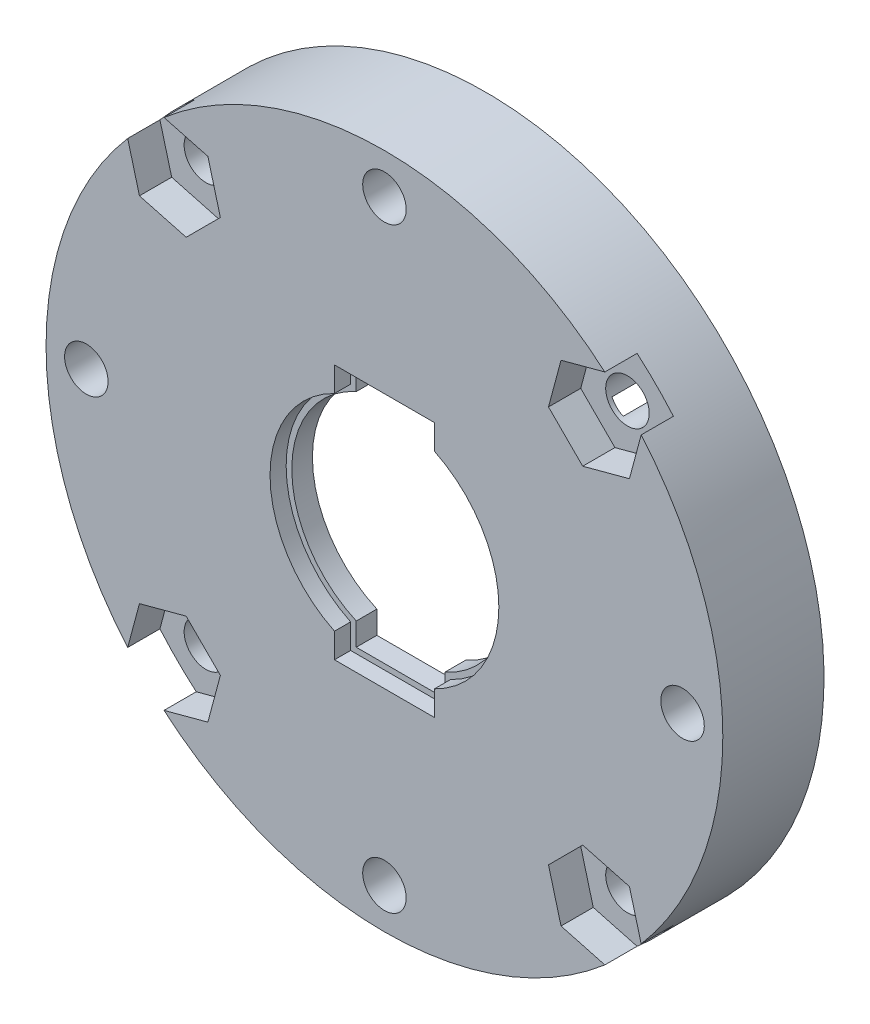
from build123d import *

# Parameters (mm, degrees)
SKETCH3_R           = 21
BOSS_EXTRUDE2_DEPTH = 1
SKETCH4_R           = 21
BOSS_EXTRUDE3_DEPTH = 5.28
SKETCH5_R           = 17.25
CUT_EXTRUDE1_DEPTH  = 4
CUT_EXTRUDE2_DEPTH  = 2
SKETCH8_R           = 1.35
CUT_EXTRUDE4_DEPTH  = 31.355203837
CIRPATTERN1_COUNT   = 4
CIRPATTERN2_COUNT   = 8


with BuildPart() as part:
    # Sketch3 → Boss-Extrude2 (new body)
    with BuildSketch(Plane.XY):
        Circle(SKETCH3_R)
        with BuildLine():
            Line((-3.099988, -6.387493593), (-3.099988, -7.924679))
            Line((-3.099988, -7.924679), (3.100012, -7.924679))
            Line((3.100012, -7.924679), (3.100012, -6.387481945))
            ThreePointArc((3.100012, -6.387481945), (7.1, 0), (3.100012, 6.387481945))
            Line((3.100012, 6.387481945), (3.100012, 7.924431))
            Line((3.100012, 7.924431), (-3.099988, 7.924431))
            Line((-3.099988, 7.924431), (-3.099988, 6.387493593))
            ThreePointArc((-3.099988, 6.387493593), (-7.1, 0), (-3.099988, -6.387493593))
        make_face(mode=Mode.SUBTRACT)
    extrude(amount=-BOSS_EXTRUDE2_DEPTH)

    # Sketch4 → Boss-Extrude3 (add)
    with BuildSketch(Plane(origin=(0, 0, -1), x_dir=(-1, 0, 0), z_dir=(0, 0, -1))):
        Circle(SKETCH4_R)
        with BuildLine():
            Line((2.749988, 6.164419356), (2.749988, 7.574431))
            Line((2.749988, 7.574431), (-2.750012, 7.574431))
            Line((-2.750012, 7.574431), (-2.750012, 6.16440865))
            ThreePointArc((-2.750012, 6.16440865), (-6.75, 0), (-2.750012, -6.16440865))
            Line((-2.750012, -6.16440865), (-2.750012, -7.574679))
            Line((-2.750012, -7.574679), (2.749988, -7.574679))
            Line((2.749988, -7.574679), (2.749988, -6.164419356))
            ThreePointArc((2.749988, -6.164419356), (6.75, 0), (2.749988, 6.164419356))
        make_face(mode=Mode.SUBTRACT)
    extrude(amount=BOSS_EXTRUDE3_DEPTH)

    # Sketch5 → Cut-Extrude1 (cut)
    with BuildSketch(Plane(origin=(0, 0, -6.28), x_dir=(-1, 0, 0), z_dir=(0, 0, -1))):
        Circle(SKETCH5_R)
    extrude(amount=-CUT_EXTRUDE1_DEPTH, mode=Mode.SUBTRACT)

    # Sketch6 → Cut-Extrude2 (cut)
    with BuildSketch(Plane.XY):
        Polygon((13.858507528, 15.981398638), (10.958584342, 15.204366562), (10.181552266, 12.304443376), (12.304443376, 10.181552266), (15.204366562, 10.958584342), (15.981398638, 13.858507528), align=None)
    cut_extrude2 = extrude(amount=-CUT_EXTRUDE2_DEPTH, mode=Mode.SUBTRACT)

    # Sketch8 → Cut-Extrude4 (cut, through all)
    with BuildSketch(Plane.XY):
        with Locations((13.081475452, 13.081475452)):
            Circle(SKETCH8_R)
    cut_extrude4 = extrude(amount=-CUT_EXTRUDE4_DEPTH, mode=Mode.SUBTRACT)

    # CirPattern1: Cut-Extrude2, Cut-Extrude4 ×4 about axis
    cirpattern1_axis = Axis((0, 0, -0.1), (0, 0, 1))
    add([cut_extrude2.rotate(cirpattern1_axis, i * 360 / CIRPATTERN1_COUNT) for i in range(1, CIRPATTERN1_COUNT)], mode=Mode.SUBTRACT)
    add([cut_extrude4.rotate(cirpattern1_axis, i * 360 / CIRPATTERN1_COUNT) for i in range(1, CIRPATTERN1_COUNT)], mode=Mode.SUBTRACT)

    # CirPattern2: Cut-Extrude4 ×8 about axis
    cirpattern2_axis = Axis((0, 0, -0.1), (0, 0, 1))
    for i in range(1, CIRPATTERN2_COUNT):
        add(cut_extrude4.rotate(cirpattern2_axis, i * 360 / CIRPATTERN2_COUNT), mode=Mode.SUBTRACT)


solid = part.part
